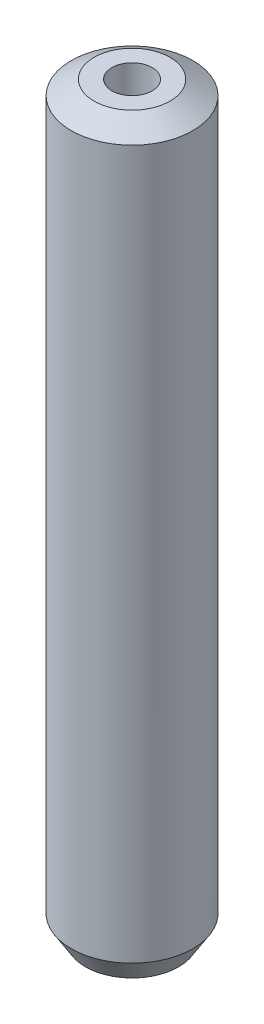
from build123d import *
from OCP.BRepFilletAPI import BRepFilletAPI_MakeChamfer

# Parameters (mm, degrees)
SKETCH1_R           = 12.5
BOSS_EXTRUDE1_DEPTH = 153.27317821
SKETCH2_R           = 4.144281368
CUT_EXTRUDE1_DEPTH  = 155.289232154
CHAMFER1_SIZE       = 2.915060843
CHAMFER1_SIZE2      = 4.693850323


with BuildPart() as part:
    # Sketch1 → Boss-Extrude1 (new body)
    with BuildSketch(Plane(origin=(0, 0, 0), x_dir=(1, 0, 0), z_dir=(0, 1, 0))):
        Circle(SKETCH1_R)
    extrude(amount=BOSS_EXTRUDE1_DEPTH)

    # Sketch2 → Cut-Extrude1 (cut, through all)
    with BuildSketch(Plane(origin=(0, 0, 0), x_dir=(1, 0, 0), z_dir=(0, 1, 0))):
        Circle(SKETCH2_R)
    extrude(amount=CUT_EXTRUDE1_DEPTH, mode=Mode.SUBTRACT)

    # Chamfer1: one chamfer whose edges measure the first distance from different faces: ONE call of the kernel's chamfer builder (chamfer() names one face for all edges)
    chamfer1_edges_1 = [part.edges().sort_by_distance(p)[0] for p in [
        (-12.5, 153.27317821, 0),
    ]]
    chamfer1_side_1 = [part.faces().sort_by_distance(p)[0] for p in [
        (-12.5, 76.636589105, 0),
    ]]
    chamfer1_edges_2 = [part.edges().sort_by_distance(p)[0] for p in [
        (-12.5, 0, 0),
    ]]
    chamfer1_side_2 = [part.faces().sort_by_distance(p)[0] for p in [
        (-12.146446609, 0, 0),
    ]]
    chamfer1 = BRepFilletAPI_MakeChamfer(part.part.solid().wrapped)
    for e in chamfer1_edges_1:
        chamfer1.Add(CHAMFER1_SIZE, CHAMFER1_SIZE2, e.wrapped, chamfer1_side_1[0].wrapped)  # the first distance lies on this face
    for e in chamfer1_edges_2:
        chamfer1.Add(CHAMFER1_SIZE, CHAMFER1_SIZE2, e.wrapped, chamfer1_side_2[0].wrapped)  # the first distance lies on this face
    add(Compound.cast(chamfer1.Shape()), mode=Mode.REPLACE)


solid = part.part
